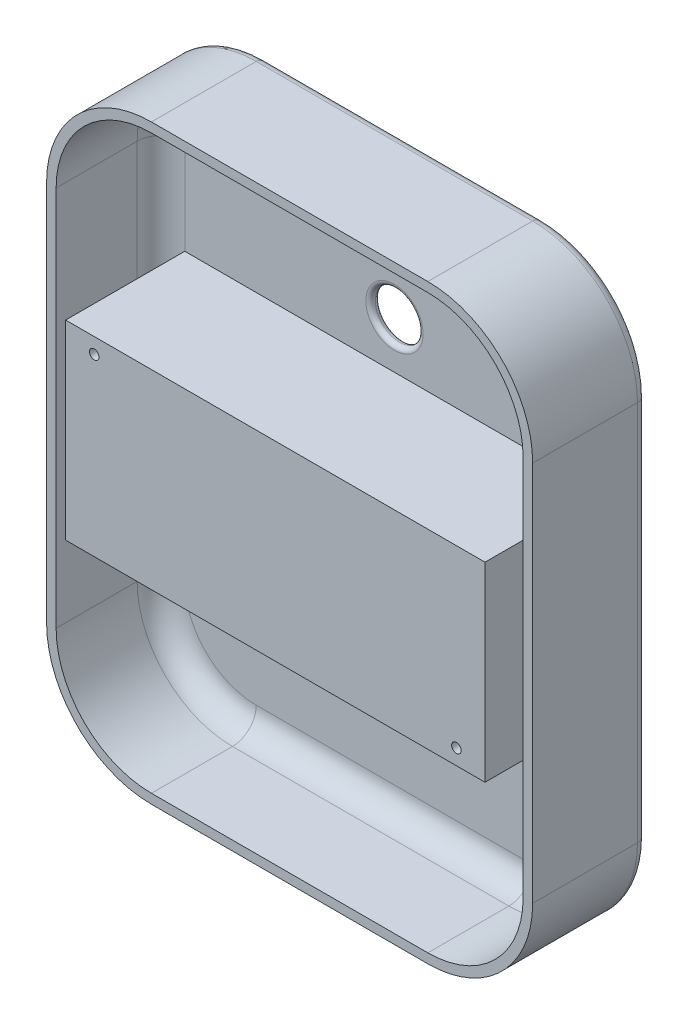
from build123d import *

# Parameters (mm, degrees)
BOSS_EXTRUDE1_DEPTH = 22
SKETCH3_W           = 88
SKETCH3_H           = 40
SKETCH3_R           = 1
BOSS_EXTRUDE2_DEPTH = 25
SKETCH6_R           = 1.75
SKETCH6_R_2         = 5
BOSS_EXTRUDE3_DEPTH = 2
FILLET10_R          = 5
FILLET12_R          = 2
FILLET13_R          = 1
FILLET14_R          = 1


with BuildPart() as part:
    # Sketch1 → Boss-Extrude1 (new body)
    with BuildSketch(Plane.XY):
        with BuildLine():
            Line((-29, 62), (29, 62))
            ThreePointArc((29, 62), (44.556349186, 55.556349186), (51, 40))
            Line((51, 40), (51, -40))
            ThreePointArc((51, -40), (44.556349186, -55.556349186), (29, -62))
            Line((29, -62), (-29, -62))
            ThreePointArc((-29, -62), (-44.556349186, -55.556349186), (-51, -40))
            Line((-51, -40), (-51, 40))
            ThreePointArc((-51, 40), (-44.556349186, 55.556349186), (-29, 62))
        make_face()
        with BuildLine():
            Line((-29, 60), (29, 60))
            ThreePointArc((29, 60), (43.142135624, 54.142135624), (49, 40))
            Line((49, 40), (49, -40))
            ThreePointArc((49, -40), (43.142135624, -54.142135624), (29, -60))
            Line((29, -60), (-29, -60))
            ThreePointArc((-29, -60), (-43.142135624, -54.142135624), (-49, -40))
            Line((-49, -40), (-49, 40))
            ThreePointArc((-49, 40), (-43.142135624, 54.142135624), (-29, 60))
        make_face(mode=Mode.SUBTRACT)
    extrude(amount=BOSS_EXTRUDE1_DEPTH)


with BuildPart() as body_2:
    # Sketch3 → Boss-Extrude2 (new body)
    with BuildSketch(Plane.XY):
        Rectangle(SKETCH3_W, SKETCH3_H)
        with Locations((-38, 16.75)):
            Circle(SKETCH3_R, mode=Mode.SUBTRACT)
        with Locations((38, -16.75)):
            Circle(SKETCH3_R, mode=Mode.SUBTRACT)
    extrude(amount=BOSS_EXTRUDE2_DEPTH)


with BuildPart() as body_3:
    # Sketch6 → Boss-Extrude3 (new body)
    with BuildSketch(Plane.XY):
        with BuildLine():
            Line((-29, 62), (29, 62))
            ThreePointArc((29, 62), (44.556349186, 55.556349186), (51, 40))
            Line((51, 40), (51, -40))
            ThreePointArc((51, -40), (44.556349186, -55.556349186), (29, -62))
            Line((29, -62), (-29, -62))
            ThreePointArc((-29, -62), (-44.556349186, -55.556349186), (-51, -40))
            Line((-51, -40), (-51, 40))
            ThreePointArc((-51, 40), (-44.556349186, 55.556349186), (-29, 62))
        make_face()
        with Locations((0, 41)):
            Circle(SKETCH6_R, mode=Mode.SUBTRACT)
        with Locations((0, -41)):
            Circle(SKETCH6_R, mode=Mode.SUBTRACT)
        with Locations((0, 30)):
            Circle(SKETCH6_R_2, mode=Mode.SUBTRACT)
        with Locations((0, -30)):
            Circle(SKETCH6_R_2, mode=Mode.SUBTRACT)
    extrude(amount=-BOSS_EXTRUDE3_DEPTH)


with BuildPart() as part_1:
    add(part.part)

    # Combine1: union body 3
    add(body_3.part)

    # Fillet10
    fillet10_edges = [part_1.edges().sort_by_distance(p)[0] for p in [
        (43.142135624, 54.142135624, 0),
        (0, 60, 0),
        (-43.142135624, 54.142135624, 0),
        (-49, 0, 0),
        (-43.142135624, -54.142135624, 0),
        (0, -60, 0),
        (43.142135624, -54.142135624, 0),
        (49, 0, 0),
    ]]
    fillet(fillet10_edges, radius=FILLET10_R)

    # Fillet12
    fillet12_edges = [part_1.edges().sort_by_distance(p)[0] for p in [
        (-44.556349186, 55.556349186, -2),
        (0, 62, -2),
        (44.556349186, 55.556349186, -2),
        (51, 0, -2),
        (44.556349186, -55.556349186, -2),
        (0, -62, -2),
        (-44.556349186, -55.556349186, -2),
        (-51, 0, -2),
    ]]
    fillet(fillet12_edges, radius=FILLET12_R)

    # Fillet13
    fillet13_edges = [part_1.edges().sort_by_distance(p)[0] for p in [
        (-5, 30, -2),
        (-5, 30, 0),
    ]]
    fillet(fillet13_edges, radius=FILLET13_R - 0.0001)  # a hair under: the kernel refuses the full size

    # Fillet14
    fillet14_edges = [part_1.edges().sort_by_distance(p)[0] for p in [
        (-5, -30, -2),
        (-1.75, -41, -2),
        (-1.75, 41, -2),
        (-1.75, 41, 0),
        (-1.75, -41, 0),
        (-5, -30, 0),
    ]]
    fillet(fillet14_edges, radius=FILLET14_R - 0.0001)  # a hair under: the kernel refuses the full size


solid = Compound([body_2.part, part_1.part])
